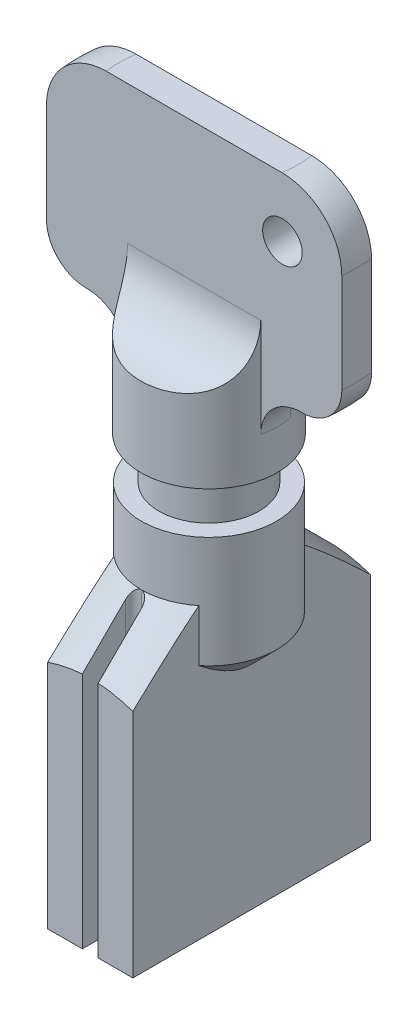
from build123d import *

# Parameters (mm, degrees)
BOSS_EXTRUDE1_DEPTH     = 10
FILLET2_R               = 2
FILLET3_R               = 3
CUT_EXTRUDE1_DEPTH      = 49.473897211
CUT_EXTRUDE1_DEPTH_BACK = 49.473897211
SKETCH3_R               = 1
SKETCH4_W               = 1.75
SKETCH4_H               = 11.625349657
BOSS_EXTRUDE2_DEPTH     = 6
CHAMFER1_SIZE           = 3
MIRROR2_START           = 14
MIRROR2_OUTLINE_W       = 1.75
MIRROR2_OUTLINE_H       = 12
MIRROR2_DEPTH           = 14.625349757
CHAMFER3_SIZE           = 3
FILLET4_R               = 0.4


with BuildPart() as part:
    # Sketch1 → Revolve1 (revolve)
    with BuildSketch(Plane.XY):
        Polygon((-3.448914015, 37.765821371), (-3.448914015, 33.765821371), (-2.534753992, 33.765821371), (-2.534753992, 31.624967984), (-3.41766068, 31.624967984), (-3.41766068, 23), (0, 23), (0, 37.765821371), align=None)
    revolve(axis=Axis((0, 37.765821371, 0), (0, -1, 0)))

    # Sketch2 → Boss-Extrude1 (add)
    with BuildSketch(Plane(origin=(0, 37.765821371, 0), x_dir=(1, 0, 0), z_dir=(0, 1, 0))):
        with BuildLine():
            Line((3.366379046, 0.75), (-3.366379046, 0.75))
            ThreePointArc((-3.366379046, 0.75), (-3.448914015, 0), (-3.366379046, -0.75))
            Line((-3.366379046, -0.75), (3.366379046, -0.75))
            ThreePointArc((3.366379046, -0.75), (3.428218178, -0.37726384), (3.448914015, 0))
            ThreePointArc((3.448914015, 0), (3.428218178, 0.37726384), (3.366379046, 0.75))
        make_face()
        with BuildLine():
            Line((-3.366379046, 0.75), (-7.462405778, 0.75))
            ThreePointArc((-7.462405778, 0.75), (-7.5, 0), (-7.462405778, -0.75))
            Line((-7.462405778, -0.75), (-3.366379046, -0.75))
            ThreePointArc((-3.366379046, -0.75), (-3.448914015, 0), (-3.366379046, 0.75))
        make_face()
        with BuildLine():
            ThreePointArc((7.5, 0), (7.490595548, 0.375470813), (7.462405778, 0.75))
            Line((7.462405778, 0.75), (3.366379046, 0.75))
            ThreePointArc((3.366379046, 0.75), (3.428218178, 0.37726384), (3.448914015, 0))
            ThreePointArc((3.448914015, 0), (3.428218178, -0.37726384), (3.366379046, -0.75))
            Line((3.366379046, -0.75), (7.462405778, -0.75))
            ThreePointArc((7.462405778, -0.75), (7.490595548, -0.375470813), (7.5, 0))
        make_face()
    extrude(amount=BOSS_EXTRUDE1_DEPTH)

    # Fillet2
    # the kernel refuses this fillet: 2 mm, written as the material it adds along each edge
    with BuildSketch(Plane(origin=(0, 37.765821371, 0), x_dir=(-0.09803421101524086, 0, -0.9951830452085783), z_dir=(-0.9951830452085783, 0, 0.09803421101524086))) as fillet2_piece_1_section:
        with BuildLine():
            CenterArc((3.448914015 + FILLET2_R, FILLET2_R), FILLET2_R, 180, 90)
            Line((3.448914015 + FILLET2_R, 0), (3.448914015, 0))
            Line((3.448914015, 0), (3.448914015, FILLET2_R))
        make_face()
    fillet2_piece_1 = revolve(axis=Axis((0, 37.765821371, 0), (0, -1, 0)), revolution_arc=191.251965623, mode=Mode.PRIVATE)
    fillet2_piece_1 = split(fillet2_piece_1, bisect_by=Plane(origin=(0, 37.765821371, -0.75), z_dir=(0, 0, 1)), keep=Keep.TOP, mode=Mode.PRIVATE)
    fillet2_piece_1 = split(fillet2_piece_1, bisect_by=Plane(origin=(0, 37.765821371, 0.75), z_dir=(0, 0, -1)), keep=Keep.TOP, mode=Mode.PRIVATE)
    add(fillet2_piece_1)
    with BuildSketch(Plane(origin=(0, 37.765821371, 0), x_dir=(0.09800035789508027, 0, 0.9951863794548418), z_dir=(0.9951863794548418, 0, -0.09800035789508027))) as fillet2_piece_2_section:
        with BuildLine():
            CenterArc((3.448914015 + FILLET2_R, FILLET2_R), FILLET2_R, 180, 90)
            Line((3.448914015 + FILLET2_R, 0), (3.448914015, 0))
            Line((3.448914015, 0), (3.448914015, FILLET2_R))
        make_face()
    fillet2_piece_2 = revolve(axis=Axis((0, 37.765821371, 0), (0, -1, 0)), revolution_arc=95.624033786, mode=Mode.PRIVATE)
    fillet2_piece_2 = split(fillet2_piece_2, bisect_by=Plane(origin=(0, 37.765821371, 0.75), z_dir=(0, 0, -1)), keep=Keep.TOP, mode=Mode.PRIVATE)
    add(fillet2_piece_2)
    with BuildSketch(Plane(origin=(0, 37.765821371, 0), x_dir=(-1, 0, 0), z_dir=(0, 0, 1))) as fillet2_piece_3_section:
        with BuildLine():
            CenterArc((3.448914015 + FILLET2_R, FILLET2_R), FILLET2_R, 180, 90)
            Line((3.448914015 + FILLET2_R, 0), (3.448914015, 0))
            Line((3.448914015, 0), (3.448914015, FILLET2_R))
        make_face()
    fillet2_piece_3 = revolve(axis=Axis((0, 37.765821371, 0), (0, -1, 0)), revolution_arc=95.624033786, mode=Mode.PRIVATE)
    fillet2_piece_3 = split(fillet2_piece_3, bisect_by=Plane(origin=(0, 37.765821371, -0.75), z_dir=(0, 0, 1)), keep=Keep.TOP, mode=Mode.PRIVATE)
    add(fillet2_piece_3)
    # the kernel refuses this fillet: 2 mm, written as the material it takes off along each edge
    with BuildSketch(Plane(origin=(0, 37.765821371, 0), x_dir=(-0.7201079494948177, 0, -0.6938620475817721), z_dir=(0.6938620475817721, 0, -0.7201079494948177))) as fillet2_2_piece_1:
        with BuildLine():
            CenterArc((7.5 - FILLET2_R, FILLET2_R), FILLET2_R, 270, 90)
            Line((7.5, FILLET2_R), (7.5, 0))
            Line((7.5, 0), (7.5 - FILLET2_R, 0))
        make_face()
    revolve(axis=Axis((0, 37.765821371, 0), (0, 1, 0)), revolution_arc=87.873212667, mode=Mode.SUBTRACT)
    with BuildSketch(Plane(origin=(0, 37.765821371, 0), x_dir=(0.7201079494948216, 0, 0.6938620475817678), z_dir=(-0.6938620475817678, 0, 0.7201079494948216))) as fillet2_2_piece_2:
        with BuildLine():
            CenterArc((7.5 - FILLET2_R, FILLET2_R), FILLET2_R, 270, 90)
            Line((7.5 - FILLET2_R, 0), (7.5, 0))
            Line((7.5, 0), (7.5, FILLET2_R))
        make_face()
    revolve(axis=Axis((0, 37.765821371, 0), (0, 1, 0)), revolution_arc=87.873212667, mode=Mode.SUBTRACT)

    # Fillet3
    # the kernel refuses this fillet: 3 mm, written as the material it adds along each edge
    with BuildSketch(Plane(origin=(10.866379046, 37.765821371, -0.75), x_dir=(0, 1, 0), z_dir=(-1, 0, 0))) as fillet3_piece_1_section:
        with BuildLine():
            CenterArc((FILLET3_R, FILLET3_R), FILLET3_R, 180, 90)
            Line((0, FILLET3_R), (0, 0))
            Line((0, 0), (FILLET3_R, 0))
        make_face()
    fillet3_piece_1 = extrude(amount=21.732758092, mode=Mode.PRIVATE)
    fillet3_piece_1 = fillet3_piece_1 & Plane(origin=(0, 37.765821371, 0), x_dir=(-1, 0, 0), z_dir=(0, -1, 0)) * Cylinder(3.448914015, 56, mode=Mode.PRIVATE)
    add(fillet3_piece_1)
    with BuildSketch(Plane(origin=(10.866379046, 37.765821371, 0.75), x_dir=(0, 1, 0), z_dir=(-1, 0, 0))) as fillet3_piece_2_section:
        with BuildLine():
            CenterArc((FILLET3_R, -FILLET3_R), FILLET3_R, 90, 90)
            Line((0, -FILLET3_R), (0, 0))
            Line((0, 0), (FILLET3_R, 0))
        make_face()
    fillet3_piece_2 = extrude(amount=21.732758092, mode=Mode.PRIVATE)
    fillet3_piece_2 = fillet3_piece_2 & Plane(origin=(0, 37.765821371, 0), x_dir=(-1, 0, 0), z_dir=(0, -1, 0)) * Cylinder(3.448914015, 56, mode=Mode.PRIVATE)
    add(fillet3_piece_2)
    # the kernel refuses this fillet: 3 mm, written as the material it takes off along each edge
    with BuildSketch(Plane(origin=(0, 47.765821371, 0), x_dir=(-0.4534410859899706, 0, -0.8912862511764871), z_dir=(0.8912862511764871, 0, -0.4534410859899706))) as fillet3_2_piece_1:
        with BuildLine():
            CenterArc((7.5 - FILLET3_R, -FILLET3_R), FILLET3_R, 0, 90)
            Line((7.5 - FILLET3_R, 0), (7.5, 0))
            Line((7.5, 0), (7.5, -FILLET3_R))
        make_face()
    revolve(axis=Axis((0, 47.765821371, 0), (0, 1, 0)), revolution_arc=126.070648523, mode=Mode.SUBTRACT)
    with BuildSketch(Plane(origin=(0, 47.765821371, 0), x_dir=(0.4534410859901425, 0, -0.8912862511763997), z_dir=(-0.8912862511763997, 0, -0.4534410859901425))) as fillet3_2_piece_2:
        with BuildLine():
            CenterArc((7.5 - FILLET3_R, FILLET3_R), FILLET3_R, 270, 90)
            Line((7.5, FILLET3_R), (7.5, 0))
            Line((7.5, 0), (7.5 - FILLET3_R, 0))
        make_face()
    revolve(axis=Axis((0, 47.765821371, 0), (0, -1, 0)), revolution_arc=126.070648523, mode=Mode.SUBTRACT)

    # Sketch3 → Cut-Extrude1 (cut, two sides: drawn at the far end of the back side and taken through both)
    with BuildSketch(Plane.XY.offset(-CUT_EXTRUDE1_DEPTH_BACK)):
        with Locations((4.462405778, 44.765821371)):
            Circle(SKETCH3_R)
    extrude(amount=CUT_EXTRUDE1_DEPTH + CUT_EXTRUDE1_DEPTH_BACK, mode=Mode.SUBTRACT)

    # Sketch4 → Boss-Extrude2 (add, symmetric)
    with BuildSketch(Plane.XY):
        with Locations((1.275, 19.812674829)):
            Rectangle(SKETCH4_W, SKETCH4_H)
    extrude(amount=BOSS_EXTRUDE2_DEPTH, both=True)

    # Chamfer1
    # the kernel refuses this chamfer: 3 mm, written as the material it adds along each edge
    with BuildSketch(Plane(origin=(0, 25.625349657, 0), x_dir=(-0.4691865734400816, 0, 0.8830990653961507), z_dir=(0.8830990653961507, 0, 0.4691865734400816))) as chamfer1_piece_1_section:
        Polygon((3.41766068, -CHAMFER1_SIZE), (3.41766068 + CHAMFER1_SIZE, 0), (3.41766068, 0), align=None)
    chamfer1_piece_1 = revolve(axis=Axis((0, 25.625349657, 0), (0, -1, 0)), revolution_arc=359.64, mode=Mode.PRIVATE)
    chamfer1_piece_1 = split(chamfer1_piece_1, bisect_by=Plane(origin=(0.4, 25.625349657, 0), z_dir=(1, 0, 0)), keep=Keep.TOP, mode=Mode.PRIVATE)
    chamfer1_piece_1 = split(chamfer1_piece_1, bisect_by=Plane(origin=(2.15, 25.625349657, 0), z_dir=(-1, 0, 0)), keep=Keep.TOP, mode=Mode.PRIVATE)
    chamfer1_piece_1 = split(chamfer1_piece_1, bisect_by=Plane(origin=(0, 25.625349657, 6), z_dir=(0, 0, -1)), keep=Keep.TOP, mode=Mode.PRIVATE)
    chamfer1_piece_1 = split(chamfer1_piece_1, bisect_by=Plane(origin=(0, 25.625349657, -6), z_dir=(0, 0, 1)), keep=Keep.TOP, mode=Mode.PRIVATE)
    add(chamfer1_piece_1)
    with BuildSketch(Plane(origin=(0, 25.625349657, 0), x_dir=(-0.4636286735350757, 0, -0.8860296005642849), z_dir=(-0.8860296005642849, 0, 0.4636286735350757))) as chamfer1_piece_2_section:
        Polygon((3.41766068, -CHAMFER1_SIZE), (3.41766068 + CHAMFER1_SIZE, 0), (3.41766068, 0), align=None)
    chamfer1_piece_2 = revolve(axis=Axis((0, 25.625349657, 0), (0, -1, 0)), revolution_arc=359.64, mode=Mode.PRIVATE)
    chamfer1_piece_2 = split(chamfer1_piece_2, bisect_by=Plane(origin=(0.4, 25.625349657, 0), z_dir=(1, 0, 0)), keep=Keep.TOP, mode=Mode.PRIVATE)
    chamfer1_piece_2 = split(chamfer1_piece_2, bisect_by=Plane(origin=(2.15, 25.625349657, 0), z_dir=(-1, 0, 0)), keep=Keep.TOP, mode=Mode.PRIVATE)
    chamfer1_piece_2 = split(chamfer1_piece_2, bisect_by=Plane(origin=(0, 25.625349657, 6), z_dir=(0, 0, -1)), keep=Keep.TOP, mode=Mode.PRIVATE)
    chamfer1_piece_2 = split(chamfer1_piece_2, bisect_by=Plane(origin=(0, 25.625349657, -6), z_dir=(0, 0, 1)), keep=Keep.TOP, mode=Mode.PRIVATE)
    add(chamfer1_piece_2)

    # Mirror2: read off the stored shape, not the designer's step
    # Mirror2 outline → Mirror2 (add)
    with BuildSketch(Plane(origin=(0, 0, 0), x_dir=(1, 0, 0), z_dir=(0, 1, 0)).offset(MIRROR2_START)):
        with Locations((-1.275, 0)):
            Rectangle(MIRROR2_OUTLINE_W, MIRROR2_OUTLINE_H)
    extrude(amount=MIRROR2_DEPTH)

    # Mirror2 2 outline → Mirror2 2 (revolve, cut)
    with BuildSketch(Plane.XY):
        Polygon((6.373578273, 28.625349757), (3.41766068, 28.625349757), (6.373578273, 25.669432065), align=None)
    revolve(axis=Axis((0, 0, 0), (0, 1, 0)), mode=Mode.SUBTRACT)

    # Chamfer3
    # the kernel refuses this chamfer: 3 mm, written as the material it takes off along each edge
    with BuildSketch(Plane(origin=(0, 23, 0), x_dir=(0.9999787092407073, 0, -0.0065254168670582325), z_dir=(-0.0065254168670582325, 0, -0.9999787092407073))) as chamfer3_piece_1_section:
        Polygon((3.41766068, -CHAMFER3_SIZE), (3.41766068 - CHAMFER3_SIZE, 0), (3.41766068, 0), align=None)
    chamfer3_piece_1 = revolve(axis=Axis((0, 23, 0), (0, -1, 0)), revolution_arc=180.373881499, mode=Mode.PRIVATE)
    chamfer3_piece_1 = split(chamfer3_piece_1, bisect_by=Plane(origin=(2.15, 23, 0), z_dir=(1, 0, 0)), keep=Keep.TOP, mode=Mode.PRIVATE)
    add(chamfer3_piece_1, mode=Mode.SUBTRACT)
    with BuildSketch(Plane(origin=(0, 23, 0), x_dir=(0.9999787092407073, 0, -0.0065254168670582325), z_dir=(-0.0065254168670582325, 0, -0.9999787092407073))) as chamfer3_piece_2_section:
        Polygon((3.41766068, -CHAMFER3_SIZE), (3.41766068 - CHAMFER3_SIZE, 0), (3.41766068, 0), align=None)
    chamfer3_piece_2 = revolve(axis=Axis((0, 23, 0), (0, -1, 0)), revolution_arc=180.373881499, mode=Mode.PRIVATE)
    chamfer3_piece_2 = split(chamfer3_piece_2, bisect_by=Plane(origin=(-2.15, 23, 0), z_dir=(-1, 0, 0)), keep=Keep.TOP, mode=Mode.PRIVATE)
    add(chamfer3_piece_2, mode=Mode.SUBTRACT)
    with BuildSketch(Plane(origin=(0, 23, 0), x_dir=(-0.9999950652018582, 0, -0.003141587485879368), z_dir=(-0.003141587485879368, 0, 0.9999950652018582))) as chamfer3_piece_3_section:
        Polygon((3.41766068, -CHAMFER3_SIZE), (3.41766068 - CHAMFER3_SIZE, 0), (3.41766068, 0), align=None)
    chamfer3_piece_3 = revolve(axis=Axis((0, 23, 0), (0, -1, 0)), revolution_arc=359.64, mode=Mode.PRIVATE)
    chamfer3_piece_3 = split(chamfer3_piece_3, bisect_by=Plane(origin=(-2.15, 23, 0), z_dir=(-1, 0, 0)), keep=Keep.TOP, mode=Mode.PRIVATE)
    add(chamfer3_piece_3, mode=Mode.SUBTRACT)
    with BuildSketch(Plane(origin=(0, 23, 0), x_dir=(-0.9999950652018582, 0, -0.003141587485879368), z_dir=(-0.003141587485879368, 0, 0.9999950652018582))) as chamfer3_piece_4_section:
        Polygon((3.41766068, -CHAMFER3_SIZE), (3.41766068 - CHAMFER3_SIZE, 0), (3.41766068, 0), align=None)
    chamfer3_piece_4 = revolve(axis=Axis((0, 23, 0), (0, -1, 0)), revolution_arc=359.64, mode=Mode.PRIVATE)
    chamfer3_piece_4 = split(chamfer3_piece_4, bisect_by=Plane(origin=(2.15, 23, 0), z_dir=(1, 0, 0)), keep=Keep.TOP, mode=Mode.PRIVATE)
    add(chamfer3_piece_4, mode=Mode.SUBTRACT)
    with BuildSketch(Plane(origin=(0, 23, 0), x_dir=(-1, 0, 0), z_dir=(0, 0, 1))) as chamfer3_piece_5_section:
        Polygon((3.41766068, -CHAMFER3_SIZE), (3.41766068 - CHAMFER3_SIZE, 0), (3.41766068, 0), align=None)
    chamfer3_piece_5 = revolve(axis=Axis((0, 23, 0), (0, -1, 0)), revolution_arc=180.373881499, mode=Mode.PRIVATE)
    chamfer3_piece_5 = split(chamfer3_piece_5, bisect_by=Plane(origin=(-2.15, 23, 0), z_dir=(-1, 0, 0)), keep=Keep.TOP, mode=Mode.PRIVATE)
    add(chamfer3_piece_5, mode=Mode.SUBTRACT)
    with BuildSketch(Plane(origin=(0, 23, 0), x_dir=(-1, 0, 0), z_dir=(0, 0, 1))) as chamfer3_piece_6_section:
        Polygon((3.41766068, -CHAMFER3_SIZE), (3.41766068 - CHAMFER3_SIZE, 0), (3.41766068, 0), align=None)
    chamfer3_piece_6 = revolve(axis=Axis((0, 23, 0), (0, -1, 0)), revolution_arc=180.373881499, mode=Mode.PRIVATE)
    chamfer3_piece_6 = split(chamfer3_piece_6, bisect_by=Plane(origin=(2.15, 23, 0), z_dir=(1, 0, 0)), keep=Keep.TOP, mode=Mode.PRIVATE)
    add(chamfer3_piece_6, mode=Mode.SUBTRACT)

    # Fillet4
    fillet4_edges = [part.edges().sort_by_distance(p)[0] for p in [
        (-0.4, 25.812674879, -3.394172142),
        (0.4, 25.812674829, -3.394172142),
        (-0.4, 25.812674879, 3.394172142),
        (0.4, 25.812674829, 3.394172142),
        (0.4, 23, 0),
        (-0.4, 23, 0),
    ]]
    fillet(fillet4_edges, radius=FILLET4_R - 0.0001)  # a hair under: the kernel refuses the full size


solid = part.part
